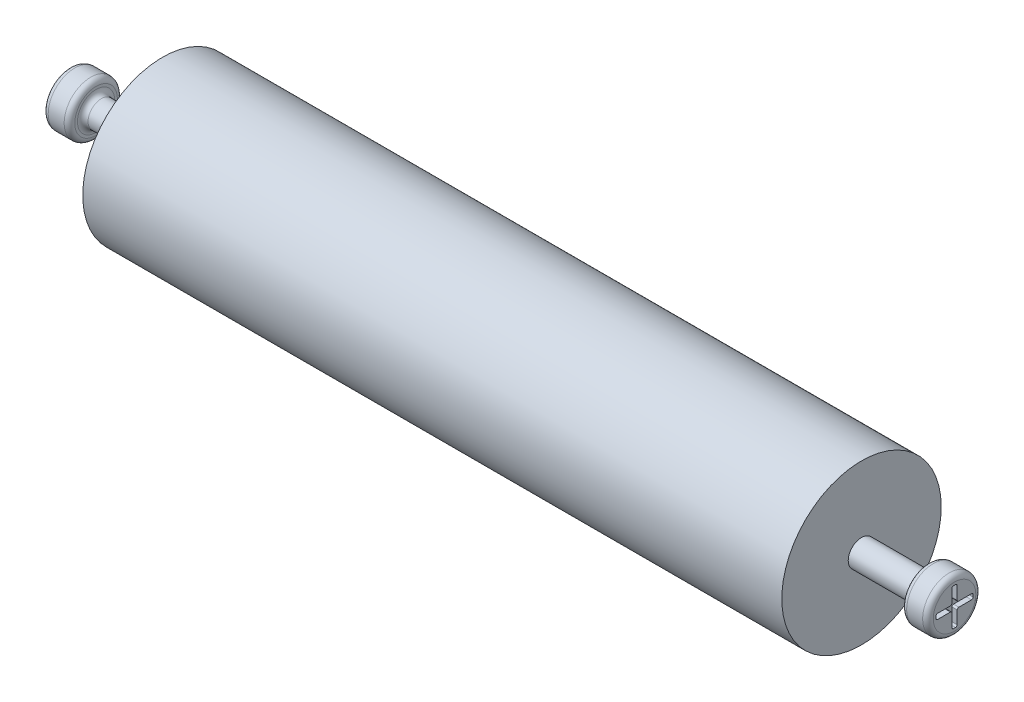
from build123d import *

# Parameters (mm, degrees)
BOSS_EXTRUDE1_DEPTH      = 167.005
BOSS_EXTRUDE1_DEPTH_BACK = 167.005
SKETCH1_R                = 38.1
SKETCH2_R                = 6.35
BOSS_EXTRUDE2_DEPTH      = 31.75
SKETCH3_R                = 12.7
BOSS_EXTRUDE3_DEPTH      = 12.7
FILLET1_R                = 2.54
CUT_EXTRUDE1_DEPTH       = 2.54
FILLET1_OF_MIRROR1_R     = 2.54


with BuildPart() as part:
    # Sketch1 → Boss-Extrude1 (new, two sides: drawn at the far end of the back side and taken through both)
    with BuildSketch(Plane(origin=(0, 0, 0), x_dir=(0, 0, -1), z_dir=(1, 0, 0)).offset(-BOSS_EXTRUDE1_DEPTH_BACK)):
        Circle(SKETCH1_R)
    extrude(amount=BOSS_EXTRUDE1_DEPTH + BOSS_EXTRUDE1_DEPTH_BACK)

    # Sketch2 → Boss-Extrude2 (add)
    with BuildSketch(Plane.ZY.offset(167.005)):
        Circle(SKETCH2_R)
    boss_extrude2 = extrude(amount=BOSS_EXTRUDE2_DEPTH)

    # Sketch3 → Boss-Extrude3 (add)
    with BuildSketch(Plane.ZY.offset(198.755)):
        Circle(SKETCH3_R)
    boss_extrude3 = extrude(amount=BOSS_EXTRUDE3_DEPTH)

    # Fillet1
    fillet1_edges = [part.edges().sort_by_distance(p)[0] for p in [
        (-198.755, 0, -6.35),
        (-198.755, 0, -12.7),
        (-211.455, 0, -12.7),
    ]]
    fillet(fillet1_edges, radius=FILLET1_R)

    # Sketch5 → Cut-Extrude1 (cut)
    with BuildSketch(Plane.ZY.offset(211.455)):
        with BuildLine():
            Line((-0.508, 8.89), (0.508, 8.89))
            ThreePointArc((0.508, 8.89), (1.046815367, 8.666815367), (1.27, 8.128))
            Line((1.27, 8.128), (1.27, 2.032))
            ThreePointArc((1.27, 2.032), (1.493184633, 1.493184633), (2.032, 1.27))
            Line((2.032, 1.27), (8.128, 1.27))
            ThreePointArc((8.128, 1.27), (8.666815367, 1.046815367), (8.89, 0.508))
            Line((8.89, 0.508), (8.89, -0.508))
            ThreePointArc((8.89, -0.508), (8.666815367, -1.046815367), (8.128, -1.27))
            Line((8.128, -1.27), (2.032, -1.27))
            ThreePointArc((2.032, -1.27), (1.493184633, -1.493184633), (1.27, -2.032))
            Line((1.27, -2.032), (1.27, -8.128))
            ThreePointArc((1.27, -8.128), (1.046815367, -8.666815367), (0.508, -8.89))
            Line((0.508, -8.89), (-0.508, -8.89))
            ThreePointArc((-0.508, -8.89), (-1.046815367, -8.666815367), (-1.27, -8.128))
            Line((-1.27, -8.128), (-1.27, -2.032))
            ThreePointArc((-1.27, -2.032), (-1.493184633, -1.493184633), (-2.032, -1.27))
            Line((-2.032, -1.27), (-8.128, -1.27))
            ThreePointArc((-8.128, -1.27), (-8.666815367, -1.046815367), (-8.89, -0.508))
            Line((-8.89, -0.508), (-8.89, 0.508))
            ThreePointArc((-8.89, 0.508), (-8.666815367, 1.046815367), (-8.128, 1.27))
            Line((-8.128, 1.27), (-2.032, 1.27))
            ThreePointArc((-2.032, 1.27), (-1.493184633, 1.493184633), (-1.27, 2.032))
            Line((-1.27, 2.032), (-1.27, 8.128))
            ThreePointArc((-1.27, 8.128), (-1.046815367, 8.666815367), (-0.508, 8.89))
        make_face()
    cut_extrude1 = extrude(amount=-CUT_EXTRUDE1_DEPTH, mode=Mode.SUBTRACT)

    # Mirror1: Boss-Extrude2, Boss-Extrude3, Cut-Extrude1 across plane
    add(boss_extrude2.mirror(Plane(origin=(0, 0, 0), x_dir=(0, 0, 1), z_dir=(1, 0, 0))))
    add(boss_extrude3.mirror(Plane(origin=(0, 0, 0), x_dir=(0, 0, 1), z_dir=(1, 0, 0))))
    add(cut_extrude1.mirror(Plane(origin=(0, 0, 0), x_dir=(0, 0, 1), z_dir=(1, 0, 0))), mode=Mode.SUBTRACT)

    # Fillet1 of Mirror1
    fillet1_of_mirror1_edges = [part.edges().sort_by_distance(p)[0] for p in [
        (198.755, 0, -6.35),
        (198.755, 0, -12.7),
        (211.455, 0, -12.7),
    ]]
    fillet(fillet1_of_mirror1_edges, radius=FILLET1_OF_MIRROR1_R)


solid = part.part
